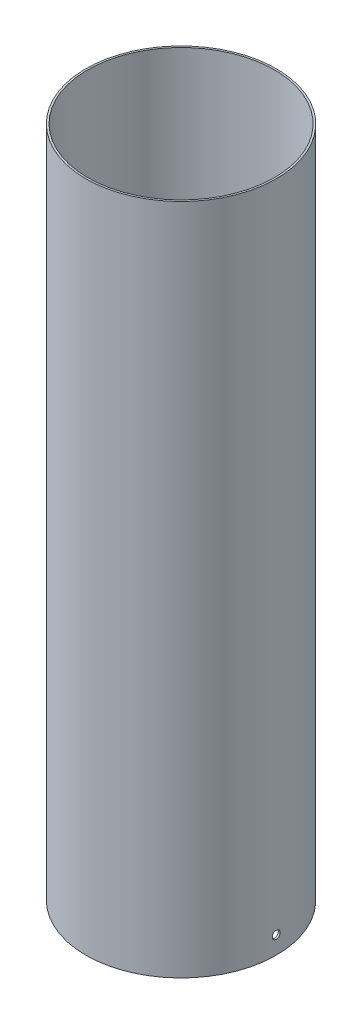
from build123d import *

# Parameters (mm, degrees)
SKETCH_1_R               = 51
SKETCH_1_R_2             = 50
EXTRUDE_1_DEPTH          = 360
CUT_EXTRUDE_1_DEPTH      = 116
CUT_EXTRUDE_1_DEPTH_BACK = 129
SKETCH_2_R               = 2.1


with BuildPart() as part:
    # Эскиз1 → Бобышка-Вытянуть1 (new body)
    with BuildSketch(Plane(origin=(0, 0, 0), x_dir=(1, 0, 0), z_dir=(0, 1, 0))):
        Circle(SKETCH_1_R)
        Circle(SKETCH_1_R_2, mode=Mode.SUBTRACT)
    extrude(amount=EXTRUDE_1_DEPTH)

    # Эскиз2 → Вырез-Вытянуть1 (cut, two sides: drawn at the far end of the back side and taken through both)
    with BuildSketch(Plane(origin=(0, 0, 0), x_dir=(0, 0, -1), z_dir=(1, 0, 0)).offset(-CUT_EXTRUDE_1_DEPTH_BACK)):
        with Locations((0, 9.5)):
            Circle(SKETCH_2_R)
    extrude(amount=CUT_EXTRUDE_1_DEPTH + CUT_EXTRUDE_1_DEPTH_BACK, mode=Mode.SUBTRACT)


solid = part.part
